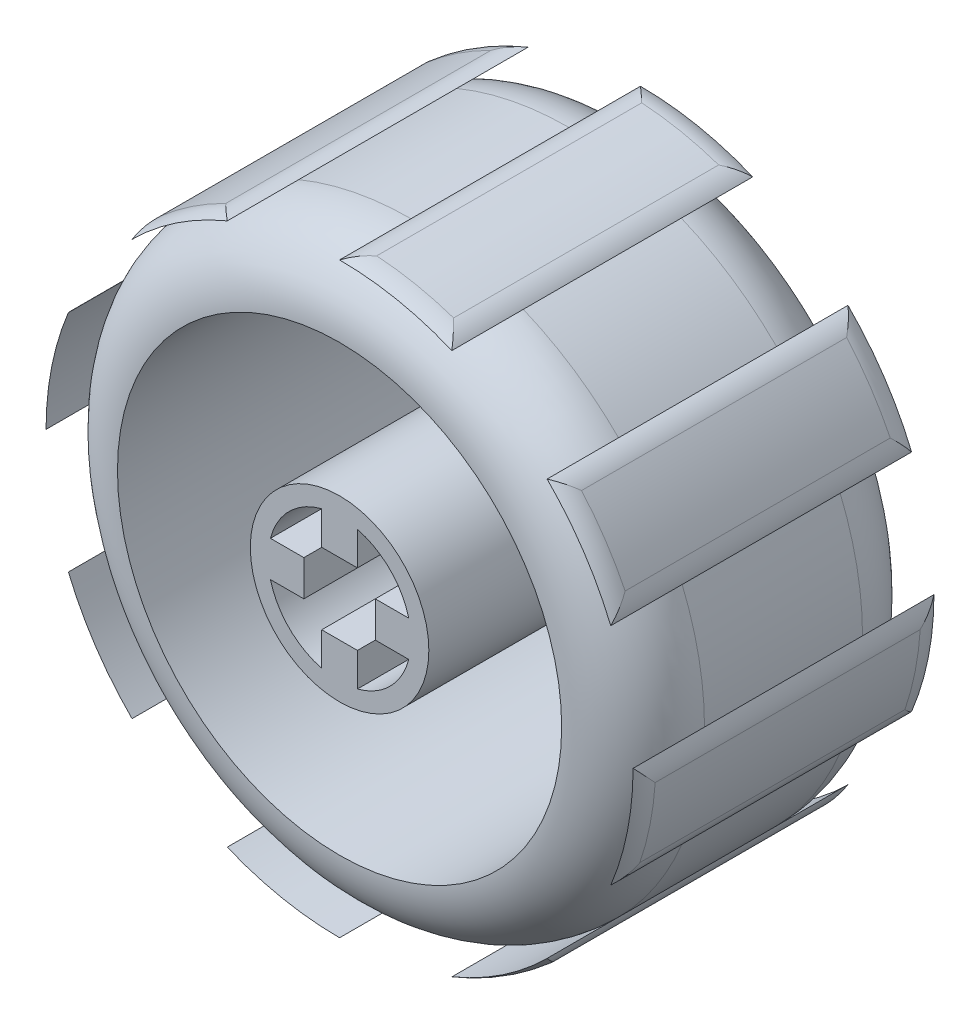
from build123d import *

# Parameters (mm, degrees)
SKETCH1_R           = 82.2
SKETCH1_R_2         = 20
BOSS_EXTRUDE1_DEPTH = 84.255
BOSS_EXTRUDE2_DEPTH = 84.255
FILLET1_R           = 20
SKETCH3_R           = 62.2
SKETCH3_R_2         = 25
CUT_EXTRUDE1_DEPTH  = 142
BOSS_EXTRUDE3_DEPTH = 84.255
FILLET2_DEPTH       = 84.255


with BuildPart() as part:
    # Sketch1 → Boss-Extrude1 (new body)
    with BuildSketch(Plane.XY):
        Circle(SKETCH1_R)
        Circle(SKETCH1_R_2, mode=Mode.SUBTRACT)
    extrude(amount=BOSS_EXTRUDE1_DEPTH)

    # Sketch2 → Boss-Extrude2 (add)
    with BuildSketch(Plane(origin=(0, 0, 0), x_dir=(-1, 0, 0), z_dir=(0, 0, -1))):
        with BuildLine():
            ThreePointArc((20, 0), (19.840593925, 2.52008585), (19.364916731, 5))
            Line((19.364916731, 5), (9.999996731, 5))
            Line((9.999996731, 5), (9.999996731, -5))
            Line((9.999996731, -5), (19.364916731, -5))
            ThreePointArc((19.364916731, -5), (19.840593925, -2.52008585), (20, 0))
        make_face()
        with BuildLine():
            ThreePointArc((5, 19.364916731), (0, 20), (-5, 19.364916731))
            Line((-5, 19.364916731), (-5, 10))
            Line((-5, 10), (5, 10))
            Line((5, 10), (5, 19.364916731))
        make_face()
        with BuildLine():
            Line((-9.999996731, 5), (-19.364916731, 5))
            ThreePointArc((-19.364916731, 5), (-20, 0), (-19.364916731, -5))
            Line((-19.364916731, -5), (-9.999996731, -5))
            Line((-9.999996731, -5), (-9.999996731, 5))
        make_face()
        with BuildLine():
            Line((-5, -10), (-5, -19.364916731))
            ThreePointArc((-5, -19.364916731), (0, -20), (5, -19.364916731))
            Line((5, -19.364916731), (5, -10))
            Line((5, -10), (-5, -10))
        make_face()
    extrude(amount=-BOSS_EXTRUDE2_DEPTH)

    # Fillet1
    fillet1_edges = [part.edges().sort_by_distance(p)[0] for p in [
        (-82.2, 0, 0),
        (-82.2, 0, 84.255),
    ]]
    fillet(fillet1_edges, radius=FILLET1_R)

    # Sketch3 → Cut-Extrude1 (cut)
    with BuildSketch(Plane(origin=(0, 0, 0), x_dir=(-1, 0, 0), z_dir=(0, 0, -1))):
        Circle(SKETCH3_R)
        Circle(SKETCH3_R_2, mode=Mode.SUBTRACT)
    extrude(amount=-CUT_EXTRUDE1_DEPTH, mode=Mode.SUBTRACT)


with BuildPart() as cut_extrude1_piece_1:
    # of the separate pieces the step leaves, piece 1, a body of its own (cut_extrude1_pieces)
    add(part.part.solids().sort_by_distance((82.2, 0, 20))[0])

    # Sketch5 → Boss-Extrude3 (add)
    with BuildSketch(Plane(origin=(0, 0, 0), x_dir=(-1, 0, 0), z_dir=(0, 0, -1))):
        with BuildLine():
            ThreePointArc((-31.45657814, 75.942897572), (-16.03642447, 80.620550049), (0, 82.2))
            Line((0, 82.2), (0, 83.546013048))
            ThreePointArc((0, 83.546013048), (-16.299018589, 81.940699834), (-31.971675034, 77.186451478))
            Line((-31.971675034, 77.186451478), (-31.45657814, 75.942897572))
        make_face()
        with BuildLine():
            ThreePointArc((-75.942897572, 31.45657814), (-68.346802131, 45.667873154), (-58.124177414, 58.124177414))
            Line((-58.124177414, 58.124177414), (-59.075952367, 59.075952367))
            ThreePointArc((-59.075952367, 59.075952367), (-69.465971078, 46.415677937), (-77.186451478, 31.971675034))
            Line((-77.186451478, 31.971675034), (-75.942897572, 31.45657814))
        make_face()
        with BuildLine():
            ThreePointArc((-75.942897572, -31.45657814), (-80.620550049, -16.03642447), (-82.2, 0))
            Line((-82.2, 0), (-83.546013048, 0))
            ThreePointArc((-83.546013048, 0), (-81.940699834, -16.299018589), (-77.186451478, -31.971675034))
            Line((-77.186451478, -31.971675034), (-75.942897572, -31.45657814))
        make_face()
        with BuildLine():
            ThreePointArc((-31.45657814, -75.942897572), (-45.667873154, -68.346802131), (-58.124177414, -58.124177414))
            Line((-58.124177414, -58.124177414), (-59.075952367, -59.075952367))
            ThreePointArc((-59.075952367, -59.075952367), (-46.415677937, -69.465971078), (-31.971675034, -77.186451478))
            Line((-31.971675034, -77.186451478), (-31.45657814, -75.942897572))
        make_face()
        with BuildLine():
            ThreePointArc((31.45657814, -75.942897572), (16.03642447, -80.620550049), (0, -82.2))
            Line((0, -82.2), (0, -83.546013048))
            ThreePointArc((0, -83.546013048), (16.299018589, -81.940699834), (31.971675034, -77.186451478))
            Line((31.971675034, -77.186451478), (31.45657814, -75.942897572))
        make_face()
        with BuildLine():
            ThreePointArc((75.942897572, -31.45657814), (68.346802131, -45.667873154), (58.124177414, -58.124177414))
            Line((58.124177414, -58.124177414), (59.075952367, -59.075952367))
            ThreePointArc((59.075952367, -59.075952367), (69.465971078, -46.415677937), (77.186451478, -31.971675034))
            Line((77.186451478, -31.971675034), (75.942897572, -31.45657814))
        make_face()
        with BuildLine():
            ThreePointArc((75.942897572, 31.45657814), (80.620550049, 16.03642447), (82.2, 0))
            Line((82.2, 0), (83.546013048, 0))
            ThreePointArc((83.546013048, 0), (81.940699834, 16.299018589), (77.186451478, 31.971675034))
            Line((77.186451478, 31.971675034), (75.942897572, 31.45657814))
        make_face()
        with BuildLine():
            ThreePointArc((31.45657814, 75.942897572), (45.667873154, 68.346802131), (58.124177414, 58.124177414))
            Line((58.124177414, 58.124177414), (59.075952367, 59.075952367))
            ThreePointArc((59.075952367, 59.075952367), (46.415677937, 69.465971078), (31.971675034, 77.186451478))
            Line((31.971675034, 77.186451478), (31.45657814, 75.942897572))
        make_face()
    extrude(amount=-BOSS_EXTRUDE3_DEPTH)

    # Fillet2: read off the stored shape, not the designer's step
    # Fillet2 outline → Fillet2 (cut)
    with BuildSketch(Plane.XY):
        with BuildLine():
            ThreePointArc((0, 82.2), (2.608384979, 83.164048917), (5.381398308, 83.372518544))
            ThreePointArc((5.381398308, 83.372518544), (2.692097142, 83.502628157), (0, 83.546013048))
            Line((0, 83.546013048), (0, 82.2))
        make_face()
        with BuildLine():
            ThreePointArc((31.971675034, 77.186451478), (29.467898906, 78.17659004), (26.933517808, 79.085535433))
            ThreePointArc((26.933517808, 79.085535433), (29.415670194, 77.831748352), (31.45657814, 75.942897572))
            Line((31.45657814, 75.942897572), (31.971675034, 77.186451478))
        make_face()
        with BuildLine():
            ThreePointArc((-58.124177414, 58.124177414), (-56.961456234, 60.650269647), (-55.148049991, 62.758496463))
            ThreePointArc((-55.148049991, 62.758496463), (-57.141674472, 60.948874762), (-59.075952367, 59.075952367))
            Line((-59.075952367, 59.075952367), (-58.124177414, 58.124177414))
        make_face()
        with BuildLine():
            ThreePointArc((-31.971675034, 77.186451478), (-34.442245804, 76.116148091), (-36.877045315, 74.966791481))
            ThreePointArc((-36.877045315, 74.966791481), (-34.235337184, 75.835376919), (-31.45657814, 75.942897572))
            Line((-31.45657814, 75.942897572), (-31.971675034, 77.186451478))
        make_face()
        with BuildLine():
            ThreePointArc((-82.2, 0), (-83.164048917, 2.608384979), (-83.372518544, 5.381398308))
            ThreePointArc((-83.372518544, 5.381398308), (-83.502628157, 2.692097142), (-83.546013048, 0))
            Line((-83.546013048, 0), (-82.2, 0))
        make_face()
        with BuildLine():
            ThreePointArc((-77.186451478, 31.971675034), (-78.17659004, 29.467898906), (-79.085535433, 26.933517808))
            ThreePointArc((-79.085535433, 26.933517808), (-77.831748352, 29.415670194), (-75.942897572, 31.45657814))
            Line((-75.942897572, 31.45657814), (-77.186451478, 31.971675034))
        make_face()
        with BuildLine():
            ThreePointArc((-58.124177414, -58.124177414), (-60.650269647, -56.961456234), (-62.758496463, -55.148049991))
            ThreePointArc((-62.758496463, -55.148049991), (-60.948874762, -57.141674472), (-59.075952367, -59.075952367))
            Line((-59.075952367, -59.075952367), (-58.124177414, -58.124177414))
        make_face()
        with BuildLine():
            ThreePointArc((-77.186451478, -31.971675034), (-76.116148091, -34.442245804), (-74.966791481, -36.877045315))
            ThreePointArc((-74.966791481, -36.877045315), (-75.835376919, -34.235337184), (-75.942897572, -31.45657814))
            Line((-75.942897572, -31.45657814), (-77.186451478, -31.971675034))
        make_face()
        with BuildLine():
            ThreePointArc((0, -82.2), (-2.608384979, -83.164048917), (-5.381398308, -83.372518544))
            ThreePointArc((-5.381398308, -83.372518544), (-2.692097142, -83.502628157), (0, -83.546013048))
            Line((0, -83.546013048), (0, -82.2))
        make_face()
        with BuildLine():
            ThreePointArc((-31.971675034, -77.186451478), (-29.467898906, -78.17659004), (-26.933517808, -79.085535433))
            ThreePointArc((-26.933517808, -79.085535433), (-29.415670194, -77.831748352), (-31.45657814, -75.942897572))
            Line((-31.45657814, -75.942897572), (-31.971675034, -77.186451478))
        make_face()
        with BuildLine():
            ThreePointArc((58.124177414, -58.124177414), (56.961456234, -60.650269647), (55.148049991, -62.758496463))
            ThreePointArc((55.148049991, -62.758496463), (57.141674472, -60.948874762), (59.075952367, -59.075952367))
            Line((59.075952367, -59.075952367), (58.124177414, -58.124177414))
        make_face()
        with BuildLine():
            ThreePointArc((31.971675034, -77.186451478), (34.442245804, -76.116148091), (36.877045315, -74.966791481))
            ThreePointArc((36.877045315, -74.966791481), (34.235337184, -75.835376919), (31.45657814, -75.942897572))
            Line((31.45657814, -75.942897572), (31.971675034, -77.186451478))
        make_face()
        with BuildLine():
            ThreePointArc((82.2, 0), (83.164048917, -2.608384979), (83.372518544, -5.381398308))
            ThreePointArc((83.372518544, -5.381398308), (83.502628157, -2.692097142), (83.546013048, 0))
            Line((83.546013048, 0), (82.2, 0))
        make_face()
        with BuildLine():
            ThreePointArc((77.186451478, -31.971675034), (78.17659004, -29.467898906), (79.085535433, -26.933517808))
            ThreePointArc((79.085535433, -26.933517808), (77.831748352, -29.415670194), (75.942897572, -31.45657814))
            Line((75.942897572, -31.45657814), (77.186451478, -31.971675034))
        make_face()
        with BuildLine():
            ThreePointArc((58.124177414, 58.124177414), (60.650269647, 56.961456234), (62.758496463, 55.148049991))
            ThreePointArc((62.758496463, 55.148049991), (60.948874762, 57.141674472), (59.075952367, 59.075952367))
            Line((59.075952367, 59.075952367), (58.124177414, 58.124177414))
        make_face()
        with BuildLine():
            ThreePointArc((77.186451478, 31.971675034), (76.116148091, 34.442245804), (74.966791481, 36.877045315))
            ThreePointArc((74.966791481, 36.877045315), (75.835376919, 34.235337184), (75.942897572, 31.45657814))
            Line((75.942897572, 31.45657814), (77.186451478, 31.971675034))
        make_face()
    extrude(amount=FILLET2_DEPTH, mode=Mode.SUBTRACT)

    # Fillet2 2 outline → Fillet2 2 (revolve, cut)
    with BuildSketch(Plane.XZ):
        with BuildLine():
            ThreePointArc((82.2, 84.255), (83.203649133, 81.838397694), (83.546013048, 79.244160766))
            Line((83.546013048, 79.244160766), (83.546013048, 84.255))
            Line((83.546013048, 84.255), (82.2, 84.255))
        make_face()
        with BuildLine():
            Line((83.546013048, 0), (83.546013048, 5.010839234))
            ThreePointArc((83.546013048, 5.010839234), (83.203649133, 2.416602306), (82.2, 0))
            Line((82.2, 0), (83.546013048, 0))
        make_face()
    revolve(axis=Axis((0, 0, 0), (0, 0, 1)), mode=Mode.SUBTRACT)


with BuildPart() as cut_extrude1_piece_2:
    # of the separate pieces the step leaves, piece 2, a body of its own (cut_extrude1_pieces)
    add(part.part.solids().sort_by_distance((-25, 0, 0))[0])


solid = Compound([cut_extrude1_piece_1.part, cut_extrude1_piece_2.part])
